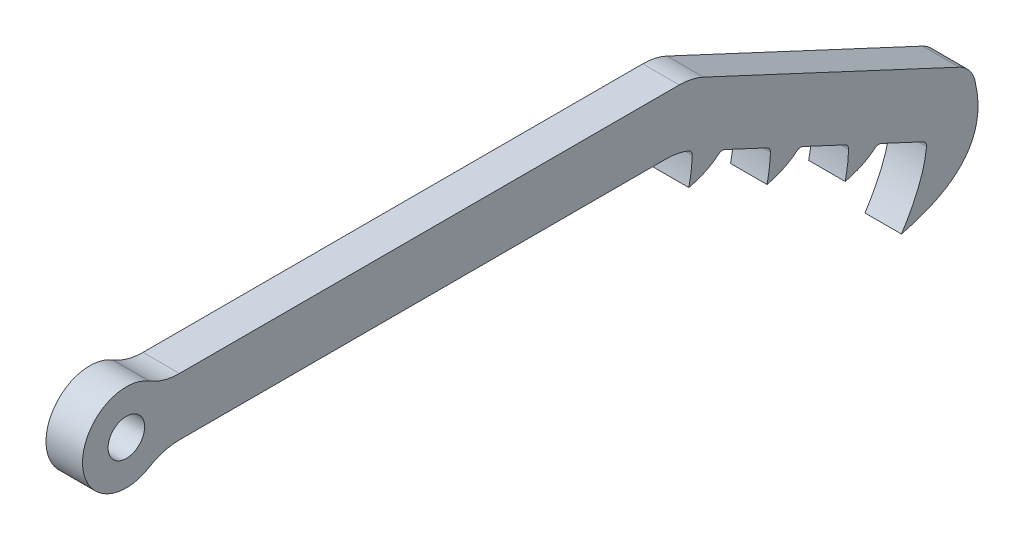
from build123d import *

# Parameters (mm, degrees)
BOSS_EXTRUDE1_DEPTH        = 6.35
F_1_4_0_2500_DOWEL_HOLE2_D = 6.35
FILLET1_R                  = 10
FILLET2_R                  = 10
FILLET4_R                  = 5
FILLET5_R                  = 1


with BuildPart() as part:
    # Sketch1 → Boss-Extrude1 (new body)
    with BuildSketch(Plane(origin=(0, 0, 0), x_dir=(0, 0, -1), z_dir=(1, 0, 0))):
        with BuildLine():
            Line((-34.29915969, 49.86223243), (56.104710487, 49.86223243))
            Line((56.104710487, 49.86223243), (58.379362515, 48.80154477))
            add(Edge.make_bspline(
                [(58.379362515, 48.80154477), (58.386228757, 46.363071997), (57.773854653, 43.567008128)],
                knots=[0, 0, 0, 1, 1, 1], degree=2))
            add(Edge.make_bspline(
                [(63.433148606, 46.444925613), (61.354068213, 44.407555536), (57.773854653, 43.567008128)],
                knots=[0.61808465, 0.61808465, 0.61808465, 1, 1, 1], degree=2))
            Line((63.433148606, 46.444925613), (71.973979321, 42.462270844))
            add(Edge.make_bspline(
                [(71.973979321, 42.462270844), (71.980845562, 40.023798071), (71.368471459, 37.227734202)],
                knots=[0, 0, 0, 1, 1, 1], degree=2))
            add(Edge.make_bspline(
                [(77.027765412, 40.105651687), (74.948685018, 38.06828161), (71.368471459, 37.227734202)],
                knots=[0.61808465, 0.61808465, 0.61808465, 1, 1, 1], degree=2))
            Line((77.027765412, 40.105651687), (85.568596126, 36.122996918))
            add(Edge.make_bspline(
                [(85.568596126, 36.122996918), (85.575462368, 33.684524145), (84.963088264, 30.888460276)],
                knots=[0, 0, 0, 1, 1, 1], degree=2))
            add(Edge.make_bspline(
                [(90.622382217, 33.766377761), (88.543301824, 31.729007684), (84.963088264, 30.888460276)],
                knots=[0.61808465, 0.61808465, 0.61808465, 1, 1, 1], degree=2))
            Line((90.622382217, 33.766377761), (99.163212932, 29.783722992))
            add(Edge.make_bspline(
                [(99.163212932, 29.783722992), (98.939072146, 24.65005498), (94.755179462, 18.075155142)],
                knots=[0, 0, 0, 1, 1, 1], degree=2))
            add(Edge.make_bspline(
                [(94.755179462, 18.075155142), (112.208752339, 22.33534385), (106.773416656, 37.268805905)],
                knots=[0.444949083, 0.444949083, 0.444949083, 1.444949083, 1.444949083, 1.444949083], degree=2))
            Line((106.773416656, 37.268805905), (58.321657114, 59.86223243))
            Line((58.321657114, 59.86223243), (-34.29915969, 59.86223243))
            ThreePointArc((-34.29915969, 59.86223243), (-47.669324906, 54.86223243), (-34.29915969, 49.86223243))
        make_face()
    extrude(amount=BOSS_EXTRUDE1_DEPTH)

    # 1/4 (0.2500) Dowel Hole2 (through all)
    with Locations(Plane(origin=(6.35, 0, 0), x_dir=(0, 0, -1), z_dir=(1, 0, 0))):
        with Locations((-40.049324906, 54.86223243)):
            Hole(F_1_4_0_2500_DOWEL_HOLE2_D / 2)

    # Fillet1
    fillet1_edges = [part.edges().sort_by_distance(p)[0] for p in [
        (3.175, 59.86223243, 34.29915969),
        (3.175, 49.86223243, 34.29915969),
    ]]
    fillet(fillet1_edges, radius=FILLET1_R)

    # Fillet2
    fillet2_edges = [part.edges().sort_by_distance(p)[0] for p in [
        (3.175, 49.86223243, -56.104710487),
        (3.175, 59.86223243, -58.321657114),
    ]]
    fillet(fillet2_edges, radius=FILLET2_R)

    # Fillet4
    fillet4_edges = [part.edges().sort_by_distance(p)[0] for p in [
        (3.175, 37.268805905, -106.773416656),
    ]]
    fillet(fillet4_edges, radius=FILLET4_R)

    # Fillet5
    fillet5_edges = [part.edges().sort_by_distance(p)[0] for p in [
        (3.175, 33.766377761, -90.622382217),
        (3.175, 40.105651687, -77.027765412),
        (3.175, 46.444925613, -63.433148606),
        (3.175, 48.80154477, -58.379362515),
        (3.175, 42.462270844, -71.973979321),
        (3.175, 36.122996918, -85.568596126),
        (3.175, 29.783722992, -99.163212932),
    ]]
    fillet(fillet5_edges, radius=FILLET5_R)


solid = part.part
